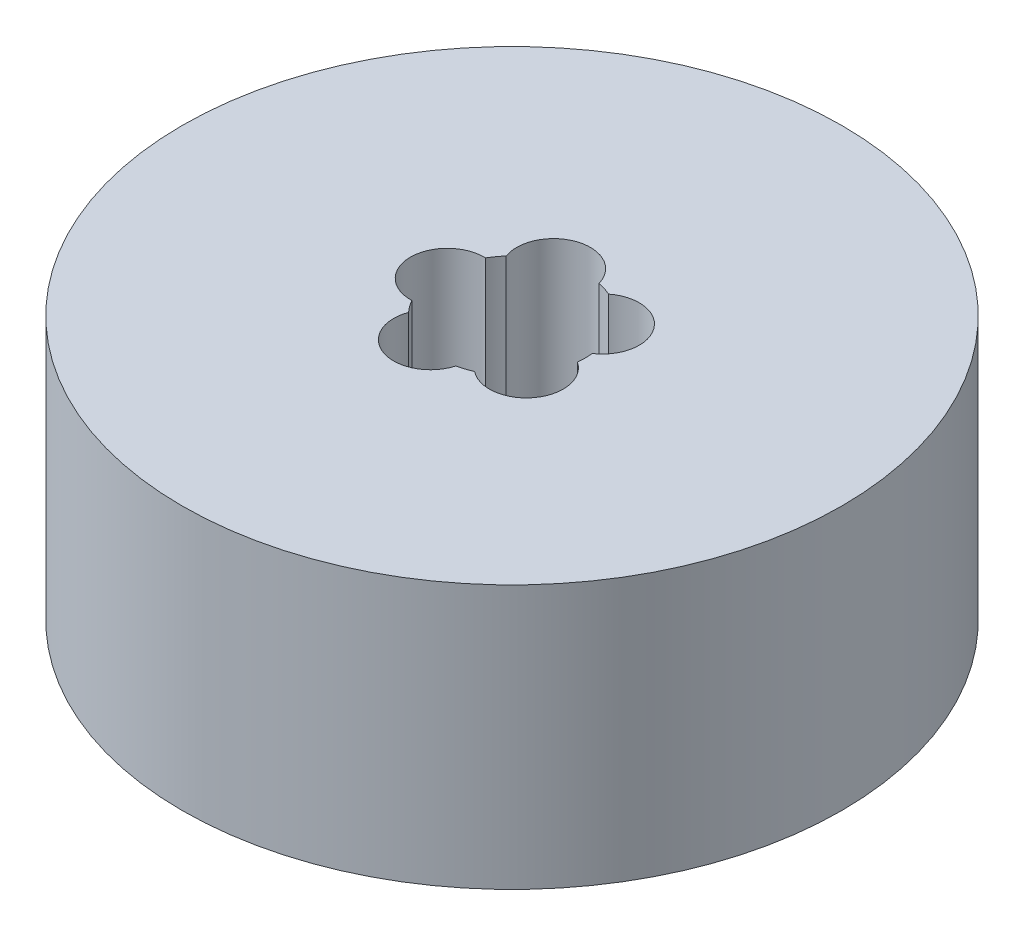
from build123d import *

# Parameters (mm, degrees)
SKETCH1_R           = 22.5
BOSS_EXTRUDE1_DEPTH = 18
SKETCH2_R           = 5
CUT_EXTRUDE1_DEPTH  = 37.558172821
SKETCH3_R           = 2.516028224
CUT_EXTRUDE2_DEPTH  = 16.893963649
CIRPATTERN1_COUNT   = 5


with BuildPart() as part:
    # Sketch1 → Boss-Extrude1 (new body)
    with BuildSketch(Plane(origin=(0, 0, 0), x_dir=(1, 0, 0), z_dir=(0, 1, 0))):
        Circle(SKETCH1_R)
    extrude(amount=BOSS_EXTRUDE1_DEPTH)

    # Sketch2 → Cut-Extrude1 (cut, through all)
    with BuildSketch(Plane(origin=(0, 0, 0), x_dir=(1, 0, 0), z_dir=(0, 1, 0))):
        Circle(SKETCH2_R)
    extrude(amount=CUT_EXTRUDE1_DEPTH, mode=Mode.SUBTRACT)

    # Sketch3 → Cut-Extrude2 (cut)
    with BuildSketch(Plane(origin=(0, 18, 0), x_dir=(1, 0, 0), z_dir=(0, 1, 0))):
        with Locations((-4.413712307, 0)):
            Circle(SKETCH3_R)
    cut_extrude2 = extrude(amount=-CUT_EXTRUDE2_DEPTH, mode=Mode.SUBTRACT)

    # CirPattern1: Cut-Extrude2 ×5 about axis
    cirpattern1_axis = Axis((0, 0, 0), (0, 1, 0))
    for i in range(1, CIRPATTERN1_COUNT):
        add(cut_extrude2.rotate(cirpattern1_axis, i * 360 / CIRPATTERN1_COUNT), mode=Mode.SUBTRACT)


solid = part.part
